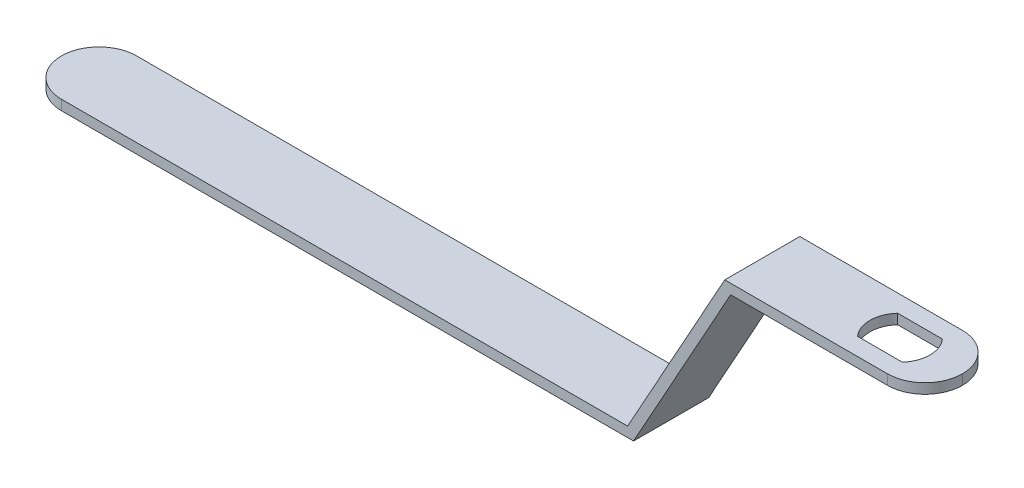
from build123d import *

# Parameters (mm, degrees)
EXTRUDE_THIN1_DEPTH = 15
FILLET1_R           = 7.5
CUT_EXTRUDE1_DEPTH  = 2
WRAP2_START         = 3
WRAP2_DEPTH         = 1


# Read off the part's stored shape, not the designer's step: Wrap2
with BuildPart() as part:
    # Sketch1 → Extrude-Thin1 (new body)
    with BuildSketch(Plane.XY):
        Polygon((0, 0), (120.6, 0), (140, 34.998526452), (180, 34.998526452), (180, 32.998526452), (141.178090033, 32.998526452), (121.778090033, -2), (0, -2), align=None)
    extrude(amount=EXTRUDE_THIN1_DEPTH)

    # Fillet1
    fillet1_edges = [part.edges().sort_by_distance(p)[0] for p in [
        (180, 33.998526452, 0),
        (180, 33.998526452, 15),
        (0, -1, 15),
        (0, -1, 0),
    ]]
    fillet(fillet1_edges, radius=FILLET1_R - 0.0001)  # a hair under: the kernel refuses the full size

    # Sketch2 → Cut-Extrude1 (cut)
    with BuildSketch(Plane(origin=(0, 34.998526452, 0), x_dir=(1, 0, 0), z_dir=(0, 1, 0))):
        with BuildLine():
            Line((163.027864045, -3.5), (171.972135955, -3.5))
            ThreePointArc((171.972135955, -3.5), (173.5, -7.5), (171.972135955, -11.5))
            Line((171.972135955, -11.5), (163.027864045, -11.5))
            ThreePointArc((163.027864045, -11.5), (161.5, -7.5), (163.027864045, -3.5))
        make_face()
    extrude(amount=-CUT_EXTRUDE1_DEPTH, mode=Mode.SUBTRACT)

    # Wrap2 outline → Wrap2 (cut)
    # profile 1 of 8: a face of its own
    with BuildSketch(Plane(origin=(0, -5, 0), x_dir=(1, 0, 0), z_dir=(0, 1, 0)).offset(WRAP2_START)):
        with BuildLine():
            Line((103.636603054, -4.873144755), (102.82250049, -4.873144755))
            add(Edge.make_bspline(
                [(102.82250049, -4.873144755), (102.821956445, -4.725585735), (102.820927731, -4.446571689), (102.814852315, -4.051410181), (102.810755363, -3.703686419), (102.803437305, -3.40345389), (102.793137917, -3.151592025), (102.782579956, -2.948114592), (102.774671335, -2.791737768), (102.763521229, -2.703865036), (102.758898727, -2.66743562)],
                knots=[0, 0, 0, 0, 0.200540395, 0.379194621, 0.537105586, 0.673145943, 0.787337723, 0.87965386, 0.950108077, 1, 1, 1, 1], degree=3))
            add(Edge.make_bspline(
                [(102.758898727, -2.66743562), (102.737223261, -2.542450891), (102.694970442, -2.298813357), (102.555099969, -1.959231973), (102.351856896, -1.66341771), (102.13640676, -1.454616366), (101.936739719, -1.312072973), (101.769235664, -1.218972783), (101.587105526, -1.139157463), (101.389760849, -1.076572685), (101.179078509, -1.025448924), (100.952784878, -0.98991022), (100.712121483, -0.970325277), (100.546440185, -0.967102613), (100.461603054, -0.965452447)],
                knots=[0, 0, 0, 0, 0.119769123, 0.233470552, 0.344312896, 0.457241494, 0.515356631, 0.576072786, 0.638240444, 0.703203992, 0.771713444, 0.843216856, 0.919719169, 1, 1, 1, 1], degree=3))
            add(Edge.make_bspline(
                [(100.461603054, -0.965452447), (100.33161862, -0.969508808), (100.060887184, -0.977957391), (99.644930356, -1.046258984), (99.203629182, -1.150817668), (98.906526538, -1.248115772), (98.751987669, -1.298725684)],
                knots=[0, 0, 0, 0, 0.222818915, 0.464086991, 0.721243174, 1, 1, 1, 1], degree=3))
            Line((98.751987669, -1.298725684), (98.751987669, -3.071942832))
            add(Edge.make_bspline(
                [(98.751987669, -3.071942832), (98.834876883, -3.049025362), (98.99296514, -3.005316624), (99.220429096, -2.956796041), (99.425381019, -2.926834702), (99.554136439, -2.921702031), (99.614427573, -2.919298601)],
                knots=[0, 0, 0, 0, 0.293681303, 0.560115882, 0.794019448, 1, 1, 1, 1], degree=3))
            add(Edge.make_bspline(
                [(99.614427573, -2.919298601), (99.680782209, -2.920696901), (99.805120569, -2.923317101), (99.977471631, -2.956651149), (100.125040886, -3.009137089), (100.201583185, -3.069079833), (100.237724849, -3.097383537)],
                knots=[0, 0, 0, 0, 0.299999302, 0.562152446, 0.79325759, 1, 1, 1, 1], degree=3))
            add(Edge.make_bspline(
                [(100.237724849, -3.097383537), (100.259595062, -3.125320883), (100.307913507, -3.18704361), (100.351831874, -3.312992841), (100.37412874, -3.472181554), (100.378046373, -3.589989445), (100.380192798, -3.654534979)],
                knots=[0, 0, 0, 0, 0.180276456, 0.398289592, 0.670330064, 1, 1, 1, 1], degree=3))
            Line((100.380192798, -3.654534979), (100.387825009, -4.873144755))
            Line((100.387825009, -4.873144755), (98.914808182, -4.873144755))
            Line((98.914808182, -4.873144755), (98.914808182, -6.826990909))
            Line((98.914808182, -6.826990909), (100.54301331, -6.826990909))
            Line((100.54301331, -6.826990909), (100.54301331, -14.153913986))
            Line((100.54301331, -14.153913986), (102.82250049, -14.153913986))
            Line((102.82250049, -14.153913986), (102.82250049, -6.826990909))
            Line((102.82250049, -6.826990909), (103.636603054, -6.826990909))
            Line((103.636603054, -6.826990909), (103.636603054, -4.873144755))
        make_face()
    # profile 2 of 8: a face of its own
    with BuildSketch(Plane(origin=(0, -5, 0), x_dir=(1, 0, 0), z_dir=(0, 1, 0)).offset(WRAP2_START)):
        with BuildLine():
            add(Edge.make_bspline(
                [(93.190649528, -4.710324242), (93.082879775, -4.712242079), (92.869446831, -4.716040264), (92.551565123, -4.747656688), (92.239240721, -4.799240188), (91.930678425, -4.866031815), (91.628743524, -4.959616875), (91.331852407, -5.071857684), (91.037350489, -5.200723259), (90.75254725, -5.354118367), (90.475385199, -5.520489352), (90.212619079, -5.704010199), (89.966430983, -5.903239414), (89.732250821, -6.113557711), (89.520991766, -6.344121662), (89.319153232, -6.583821731), (89.137640063, -6.841245533), (88.969585015, -7.110120245), (88.819966815, -7.388891019), (88.690050924, -7.675618625), (88.577296146, -7.96633885), (88.489011414, -8.264592868), (88.415919793, -8.566447801), (88.369793785, -8.875602657), (88.337001392, -9.188881638), (88.333324326, -9.399806829), (88.331474849, -9.505897159)],
                knots=[0, 0, 0, 0, 0.042598506, 0.084364343, 0.126142289, 0.167705805, 0.209066008, 0.25097289, 0.293148456, 0.336041456, 0.37876116, 0.420892731, 0.462622223, 0.503914433, 0.545187585, 0.586138136, 0.627721928, 0.669584534, 0.711432369, 0.752690541, 0.793970501, 0.834591739, 0.875576584, 0.916639513, 0.958071667, 1, 1, 1, 1], degree=3))
            add(Edge.make_bspline(
                [(88.331474849, -9.505897159), (88.333426665, -9.61281632), (88.337307318, -9.82539585), (88.368607397, -10.141621608), (88.420388341, -10.452230275), (88.487436318, -10.7590517), (88.580671157, -11.05815981), (88.689606114, -11.353963577), (88.823328059, -11.642431084), (88.971167523, -11.926709241), (89.140303094, -12.198432608), (89.321659143, -12.458435175), (89.522652278, -12.699895853), (89.732220145, -12.93030301), (89.960303023, -13.141865307), (90.203260282, -13.338017951), (90.458988588, -13.521158996), (90.729326897, -13.686991609), (91.010812627, -13.832702811), (91.298698574, -13.964073351), (91.594668133, -14.073448706), (91.898108782, -14.162641296), (92.209204545, -14.231700886), (92.527268605, -14.278613887), (92.851615968, -14.311241338), (93.07014845, -14.314891657), (93.180473246, -14.316734499)],
                knots=[0, 0, 0, 0, 0.04216776, 0.083839067, 0.125192329, 0.166335368, 0.207601958, 0.248670144, 0.290582404, 0.332926248, 0.374978427, 0.416740924, 0.457856759, 0.498808992, 0.539515963, 0.580420356, 0.621910028, 0.663502052, 0.705394285, 0.746863727, 0.788245389, 0.82973641, 0.871532383, 0.913824669, 0.956494908, 1, 1, 1, 1], degree=3))
            add(Edge.make_bspline(
                [(93.180473246, -14.316734499), (93.341790595, -14.311999516), (93.659749546, -14.302666794), (94.128027907, -14.238740089), (94.577888831, -14.128705469), (95.01006536, -13.975319634), (95.425118902, -13.778761403), (95.819427203, -13.535490743), (96.196912555, -13.250296958), (96.551036626, -12.925590528), (96.875462248, -12.569358171), (97.158887063, -12.189082301), (97.399537666, -11.790462614), (97.597197546, -11.373044549), (97.749750666, -10.936255712), (97.859920048, -10.481401951), (97.923924911, -10.007204736), (97.9331787, -9.68502147), (97.937885105, -9.521161582)],
                knots=[0, 0, 0, 0, 0.064374939, 0.126883986, 0.188200706, 0.248894086, 0.309598788, 0.371125298, 0.433465539, 0.498143129, 0.562592753, 0.625474489, 0.687114454, 0.748124994, 0.809456656, 0.871431117, 0.934610872, 1, 1, 1, 1], degree=3))
            add(Edge.make_bspline(
                [(97.937885105, -9.521161582), (97.933014574, -9.346195142), (97.923441642, -9.002302107), (97.847428351, -8.498490974), (97.726043324, -8.016115691), (97.551802765, -7.556525614), (97.329225776, -7.118873091), (97.057509714, -6.704081181), (96.735311743, -6.312055928), (96.488572615, -6.074945615), (96.363105458, -5.954374723)],
                knots=[0, 0, 0, 0, 0.130489087, 0.256473689, 0.3792365, 0.500977689, 0.622366534, 0.744855131, 0.870258513, 1, 1, 1, 1], degree=3))
            add(Edge.make_bspline(
                [(96.363105458, -5.954374723), (96.2479768, -5.854435015), (96.020851791, -5.657274661), (95.651848403, -5.407209074), (95.274030573, -5.191228698), (94.882869991, -5.013652659), (94.477276202, -4.87976319), (94.059327645, -4.782303635), (93.629111226, -4.722441121), (93.337546164, -4.714383727), (93.190649528, -4.710324242)],
                knots=[0, 0, 0, 0, 0.131014441, 0.25846437, 0.382579777, 0.504990606, 0.627227493, 0.749296729, 0.873690397, 1, 1, 1, 1], degree=3))
        make_face()
        with BuildLine():
            add(Edge.make_bspline(
                [(93.139768118, -6.826990909), (93.228023606, -6.829924229), (93.401755485, -6.835698501), (93.657493375, -6.866687478), (93.899372964, -6.930202047), (94.132198432, -7.010975196), (94.351851074, -7.118997903), (94.564346393, -7.245409363), (94.758635099, -7.403597749), (94.944119446, -7.577118837), (95.112497888, -7.769809348), (95.25597231, -7.979745515), (95.384169884, -8.198895621), (95.481375604, -8.435283025), (95.561822629, -8.682446572), (95.616268211, -8.944379673), (95.654158535, -9.218156394), (95.656971354, -9.405695324), (95.658397926, -9.500809018)],
                knots=[0, 0, 0, 0, 0.064415632, 0.126802865, 0.187422712, 0.246517508, 0.306285303, 0.365703059, 0.4264774, 0.488621826, 0.550895458, 0.612678531, 0.673914015, 0.735734248, 0.798735035, 0.86329015, 0.930665176, 1, 1, 1, 1], degree=3))
            add(Edge.make_bspline(
                [(95.658397926, -9.500809018), (95.656728643, -9.599276899), (95.653466351, -9.791713463), (95.619684634, -10.072696724), (95.563977469, -10.339347976), (95.484835047, -10.591255301), (95.385300087, -10.830226858), (95.263182233, -11.054921856), (95.117192669, -11.263989291), (94.951675937, -11.45717171), (94.770442185, -11.632525529), (94.571860408, -11.783007616), (94.364246463, -11.913756577), (94.142815798, -12.018768174), (93.910713363, -12.099845646), (93.667250142, -12.159540261), (93.411146736, -12.191700827), (93.236524686, -12.19724048), (93.14740033, -12.200067832)],
                knots=[0, 0, 0, 0, 0.071358163, 0.139455827, 0.204809025, 0.268587499, 0.330586987, 0.392213478, 0.453609543, 0.515091734, 0.576401551, 0.636039465, 0.695407414, 0.753980593, 0.813284842, 0.873377339, 0.935373778, 1, 1, 1, 1], degree=3))
            add(Edge.make_bspline(
                [(93.14740033, -12.200067832), (93.058231397, -12.197560098), (92.883408526, -12.192643484), (92.627004374, -12.155825811), (92.382297851, -12.097882051), (92.14821308, -12.016106773), (91.926642658, -11.90884746), (91.716738393, -11.777472978), (91.516653733, -11.624897821), (91.332987806, -11.446235408), (91.16297177, -11.252450522), (91.013877875, -11.042279435), (90.889289394, -10.81758438), (90.787104531, -10.579779139), (90.707806962, -10.329190574), (90.65302204, -10.064887279), (90.615111459, -9.78768835), (90.612362254, -9.597616451), (90.610962028, -9.500809018)],
                knots=[0, 0, 0, 0, 0.064469005, 0.126396675, 0.18693923, 0.24609921, 0.305348133, 0.364571657, 0.424924428, 0.486952233, 0.549550456, 0.611149272, 0.672921868, 0.735010283, 0.798048595, 0.862642915, 0.93004128, 1, 1, 1, 1], degree=3))
            add(Edge.make_bspline(
                [(90.610962028, -9.500809018), (90.612652546, -9.40403542), (90.615969891, -9.214134227), (90.649754015, -8.93656039), (90.704914485, -8.673111397), (90.785077671, -8.424912154), (90.884021009, -8.1891311), (91.00622327, -7.966975112), (91.152932808, -7.759538363), (91.319254163, -7.56784944), (91.503204722, -7.394956233), (91.698338641, -7.240777463), (91.909118032, -7.113259775), (92.131588547, -7.008139681), (92.366342073, -6.927264773), (92.613115062, -6.867231852), (92.872663796, -6.835528918), (93.049802823, -6.829866656), (93.139768118, -6.826990909)],
                knots=[0, 0, 0, 0, 0.070243401, 0.137840339, 0.202697511, 0.265405501, 0.326938422, 0.388125269, 0.449116585, 0.511100798, 0.572085896, 0.632197341, 0.691338952, 0.750563856, 0.810545842, 0.871334761, 0.934653553, 1, 1, 1, 1], degree=3))
        make_face(mode=Mode.SUBTRACT)
    # profile 3 of 8: a face of its own
    with BuildSketch(Plane(origin=(0, -5, 0), x_dir=(1, 0, 0), z_dir=(0, 1, 0)).offset(WRAP2_START)):
        with BuildLine():
            Line((84.749423567, -4.873144755), (84.749423567, -6.015432415))
            add(Edge.make_bspline(
                [(84.749423567, -6.015432415), (84.69415301, -5.913916997), (84.586124414, -5.715500899), (84.387666822, -5.449166582), (84.159670703, -5.22486725), (83.910328662, -5.03791148), (83.638884991, -4.892197815), (83.35260847, -4.788358459), (83.053948189, -4.720877266), (82.850212269, -4.713867246), (82.747240073, -4.710324242)],
                knots=[0, 0, 0, 0, 0.137332659, 0.268422379, 0.39320538, 0.516430377, 0.637792883, 0.758061252, 0.877719333, 1, 1, 1, 1], degree=3))
            add(Edge.make_bspline(
                [(82.747240073, -4.710324242), (82.67246941, -4.71382547), (82.520209642, -4.720955221), (82.288144328, -4.762400568), (82.05273072, -4.837341636), (81.897808279, -4.904816109), (81.818654336, -4.939290588)],
                knots=[0, 0, 0, 0, 0.232851034, 0.474167851, 0.731338546, 1, 1, 1, 1], degree=3))
            Line((81.818654336, -4.939290588), (82.525905939, -6.870240108))
            add(Edge.make_bspline(
                [(82.525905939, -6.870240108), (82.589124132, -6.839696133), (82.707950001, -6.782285219), (82.880464529, -6.714534425), (83.037028616, -6.673196202), (83.136287374, -6.667028177), (83.182276131, -6.664170396)],
                knots=[0, 0, 0, 0, 0.30359675, 0.570645018, 0.80107043, 1, 1, 1, 1], degree=3))
            add(Edge.make_bspline(
                [(83.182276131, -6.664170396), (83.225698461, -6.666064113), (83.311117666, -6.66978938), (83.437194022, -6.701713655), (83.555931696, -6.756766077), (83.673052649, -6.827293694), (83.779317337, -6.925332356), (83.885516388, -7.038829515), (83.979104678, -7.178956853), (84.077867465, -7.334925698), (84.161960447, -7.525831423), (84.23406759, -7.753733518), (84.298315633, -8.021268966), (84.342527058, -8.32985825), (84.385259176, -8.676515236), (84.410694382, -9.063784343), (84.429651562, -9.490440989), (84.430810667, -9.788262726), (84.431414753, -9.943477287)],
                knots=[0, 0, 0, 0, 0.034014511, 0.066912404, 0.101140702, 0.136380892, 0.173597996, 0.214075626, 0.25797978, 0.305417223, 0.358684712, 0.420923911, 0.492691001, 0.574130849, 0.665182153, 0.766512664, 0.878314341, 1, 1, 1, 1], degree=3))
            Line((84.431414753, -9.943477287), (84.423782541, -10.396321838))
            Line((84.423782541, -10.396321838), (84.423782541, -14.153913986))
            Line((84.423782541, -14.153913986), (86.703269721, -14.153913986))
            Line((86.703269721, -14.153913986), (86.703269721, -4.873144755))
            Line((86.703269721, -4.873144755), (84.749423567, -4.873144755))
        make_face()
    # profile 4 of 8: a face of its own
    with BuildSketch(Plane(origin=(0, -5, 0), x_dir=(1, 0, 0), z_dir=(0, 1, 0)).offset(WRAP2_START)):
        with BuildLine():
            Line((78.399423567, -4.873144755), (78.399423567, -5.982359499))
            add(Edge.make_bspline(
                [(78.399423567, -5.982359499), (78.298033135, -5.880027416), (78.098403709, -5.678543957), (77.767578698, -5.419518857), (77.422494713, -5.198020395), (77.058969883, -5.018703451), (76.677893375, -4.881782012), (76.281071292, -4.781448001), (75.866465392, -4.722254078), (75.584174811, -4.714344934), (75.44066956, -4.710324242)],
                knots=[0, 0, 0, 0, 0.130191077, 0.256335531, 0.379114138, 0.500550811, 0.622115809, 0.744714581, 0.870223095, 1, 1, 1, 1], degree=3))
            add(Edge.make_bspline(
                [(75.44066956, -4.710324242), (75.296974832, -4.714844081), (75.014116408, -4.723741238), (74.601427935, -4.805158563), (74.210471543, -4.937434205), (73.845548671, -5.12597688), (73.50402187, -5.358817283), (73.201021004, -5.647984683), (72.928283811, -5.981967953), (72.782904388, -6.234462896), (72.70833783, -6.363970076)],
                knots=[0, 0, 0, 0, 0.127995722, 0.251955439, 0.373413672, 0.494801292, 0.617068654, 0.7406196, 0.866961201, 1, 1, 1, 1], degree=3))
            add(Edge.make_bspline(
                [(72.70833783, -6.363970076), (72.612286467, -6.234110587), (72.423764595, -5.979232854), (72.089592407, -5.646461075), (71.728252571, -5.35878713), (71.332753992, -5.124257889), (70.913599743, -4.938077765), (70.47262399, -4.80565004), (70.013824766, -4.723877309), (69.701586717, -4.714879462), (69.543514112, -4.710324242)],
                knots=[0, 0, 0, 0, 0.130148748, 0.25544547, 0.37917652, 0.501904822, 0.625344245, 0.74827832, 0.872564212, 1, 1, 1, 1], degree=3))
            add(Edge.make_bspline(
                [(69.543514112, -4.710324242), (69.380243881, -4.715054136), (69.062290286, -4.724265164), (68.601529868, -4.81488556), (68.169971979, -4.954907668), (67.77715393, -5.158674105), (67.421955364, -5.40004352), (67.119283337, -5.685231556), (66.86809321, -6.004286784), (66.704536225, -6.302206518), (66.598801029, -6.565601678), (66.534957178, -6.79480482), (66.475243425, -7.050739117), (66.432345068, -7.336844686), (66.392301346, -7.650432357), (66.36905439, -7.993586965), (66.353253193, -8.365152503), (66.351574906, -8.622236676), (66.350705618, -8.755396358)],
                knots=[0, 0, 0, 0, 0.082624488, 0.16090351, 0.236985873, 0.311729383, 0.384306569, 0.453908175, 0.521546124, 0.589231814, 0.625292706, 0.665128129, 0.709631799, 0.75836798, 0.811604142, 0.869763281, 0.932542404, 1, 1, 1, 1], degree=3))
            Line((66.350705618, -8.755396358), (66.350705618, -14.153913986))
            Line((66.350705618, -14.153913986), (68.630192798, -14.153913986))
            Line((68.630192798, -14.153913986), (68.630192798, -9.493176806))
            add(Edge.make_bspline(
                [(68.630192798, -9.493176806), (68.632090039, -9.36851075), (68.635731622, -9.129225521), (68.651213396, -8.786016544), (68.685868227, -8.474755618), (68.726488131, -8.193718651), (68.784615997, -7.944395732), (68.855492374, -7.726185837), (68.937708541, -7.538774861), (69.036982084, -7.382182335), (69.14816857, -7.250306694), (69.271847495, -7.137263153), (69.406729319, -7.040814643), (69.554036942, -6.958605996), (69.717629448, -6.903006659), (69.891984211, -6.859381436), (70.07846561, -6.829672347), (70.207398807, -6.827901178), (70.273662349, -6.826990909)],
                knots=[0, 0, 0, 0, 0.1043212, 0.200235118, 0.287286636, 0.36626042, 0.437682721, 0.501179832, 0.55802122, 0.608412149, 0.655743055, 0.701943669, 0.748215056, 0.794251934, 0.84250453, 0.892236791, 0.944616499, 1, 1, 1, 1], degree=3))
            add(Edge.make_bspline(
                [(70.273662349, -6.826990909), (70.375773528, -6.830521157), (70.576146398, -6.837448566), (70.868130509, -6.903647721), (71.142889708, -7.011876254), (71.399394636, -7.159111587), (71.632125875, -7.343005736), (71.835706795, -7.56112173), (72.003836244, -7.814716592), (72.120219547, -8.050001756), (72.192944493, -8.262746821), (72.244245332, -8.444945885), (72.284232297, -8.650986075), (72.315530382, -8.878780683), (72.345557241, -9.129617454), (72.36028825, -9.403179195), (72.375362567, -9.699085864), (72.375166331, -9.90359544), (72.375064592, -10.00962312)],
                knots=[0, 0, 0, 0, 0.070619589, 0.138576891, 0.20607346, 0.274463188, 0.342600369, 0.410740079, 0.480118385, 0.552600476, 0.591784346, 0.635663039, 0.683568788, 0.736964635, 0.79487093, 0.858420857, 0.926598508, 1, 1, 1, 1], degree=3))
            Line((72.375064592, -10.00962312), (72.375064592, -14.153913986))
            Line((72.375064592, -14.153913986), (74.654551772, -14.153913986))
            Line((74.654551772, -14.153913986), (74.654551772, -9.704334659))
            add(Edge.make_bspline(
                [(74.654551772, -9.704334659), (74.654743158, -9.605103181), (74.655111324, -9.414213961), (74.666177642, -9.138566275), (74.680831609, -8.884043437), (74.701374764, -8.64993554), (74.725067249, -8.436533756), (74.759260964, -8.24500554), (74.795184616, -8.074295514), (74.856776204, -7.880374019), (74.943566671, -7.665476549), (75.073232898, -7.437589748), (75.230017076, -7.246788258), (75.409956494, -7.091587237), (75.613295758, -6.973336513), (75.83488365, -6.885372671), (76.078951254, -6.837892489), (76.246951075, -6.830701454), (76.33363831, -6.826990909)],
                knots=[0, 0, 0, 0, 0.078530458, 0.151067163, 0.218305464, 0.280286667, 0.337063553, 0.388152346, 0.434234333, 0.474994116, 0.549030637, 0.617296196, 0.681662637, 0.743542005, 0.804319575, 0.867012585, 0.931379026, 1, 1, 1, 1], degree=3))
            add(Edge.make_bspline(
                [(76.33363831, -6.826990909), (76.431587427, -6.830315472), (76.625576472, -6.836899796), (76.908151151, -6.907620823), (77.178318749, -7.013863565), (77.430135856, -7.165205513), (77.659360984, -7.353427253), (77.860903627, -7.577747373), (78.028149491, -7.837899795), (78.145049398, -8.079674966), (78.216713927, -8.297727727), (78.269394171, -8.484657761), (78.307893367, -8.695235421), (78.340014999, -8.927096293), (78.369864088, -9.180514063), (78.384656049, -9.456603164), (78.399715471, -9.755057574), (78.399523213, -9.961261522), (78.399423567, -10.068136742)],
                knots=[0, 0, 0, 0, 0.067433272, 0.13355216, 0.199704678, 0.267120188, 0.335277742, 0.403628311, 0.474205446, 0.54799425, 0.588135642, 0.632411552, 0.681857329, 0.73562936, 0.793897036, 0.857789304, 0.926292394, 1, 1, 1, 1], degree=3))
            Line((78.399423567, -10.068136742), (78.399423567, -14.153913986))
            Line((78.399423567, -14.153913986), (80.678910746, -14.153913986))
            Line((80.678910746, -14.153913986), (80.678910746, -4.873144755))
            Line((80.678910746, -4.873144755), (78.399423567, -4.873144755))
        make_face()
    # profile 5 of 8: a face of its own
    with BuildSketch(Plane(origin=(0, -5, 0), x_dir=(1, 0, 0), z_dir=(0, 1, 0)).offset(WRAP2_START)):
        with BuildLine():
            Line((57.069936387, -14.153913986), (57.069936387, -13.141373922))
            add(Edge.make_bspline(
                [(57.069936387, -13.141373922), (57.182884137, -13.23993349), (57.402093415, -13.43121815), (57.747496304, -13.679414859), (58.093908501, -13.884145067), (58.442994525, -14.047201512), (58.800119682, -14.167601914), (59.16785513, -14.254774618), (59.55149665, -14.306182494), (59.812290871, -14.313180525), (59.944736067, -14.316734499)],
                knots=[0, 0, 0, 0, 0.141149604, 0.273943506, 0.399987178, 0.519718967, 0.636176176, 0.754371141, 0.875256582, 1, 1, 1, 1], degree=3))
            add(Edge.make_bspline(
                [(59.944736067, -14.316734499), (60.093411687, -14.313389762), (60.387203139, -14.306780374), (60.818309478, -14.237205893), (61.234585508, -14.130706643), (61.635693328, -13.979996892), (62.020903159, -13.784706602), (62.393163024, -13.549931168), (62.746091256, -13.267428568), (63.082625859, -12.94942197), (63.390754924, -12.59961245), (63.660124261, -12.222855315), (63.887182593, -11.824494034), (64.073199334, -11.405849359), (64.219525523, -10.967228549), (64.323835157, -10.507240435), (64.385377961, -10.02572073), (64.392995226, -9.697728365), (64.396859464, -9.531337864)],
                knots=[0, 0, 0, 0, 0.061279783, 0.121092325, 0.179634237, 0.238303512, 0.297437091, 0.357506849, 0.419513154, 0.483600041, 0.548295031, 0.611486872, 0.674312645, 0.737107248, 0.800159515, 0.864737133, 0.931381158, 1, 1, 1, 1], degree=3))
            add(Edge.make_bspline(
                [(64.396859464, -9.531337864), (64.392803932, -9.359040281), (64.384848554, -9.021059374), (64.326655437, -8.525088462), (64.224270708, -8.05369498), (64.08466177, -7.60622598), (63.905079114, -7.182604155), (63.686359438, -6.782135478), (63.425527265, -6.405866709), (63.124964425, -6.060202208), (62.80043038, -5.743383997), (62.453236324, -5.467568619), (62.088811613, -5.233250622), (61.706768982, -5.041956205), (61.307162989, -4.894133561), (60.891571271, -4.786063138), (60.458148896, -4.721217088), (60.162898061, -4.713985345), (60.013425971, -4.710324242)],
                knots=[0, 0, 0, 0, 0.071017617, 0.139308968, 0.205473642, 0.26959838, 0.332253223, 0.394830003, 0.45737553, 0.520581844, 0.583374035, 0.644082429, 0.703039519, 0.761664045, 0.819843943, 0.878346403, 0.938412308, 1, 1, 1, 1], degree=3))
            add(Edge.make_bspline(
                [(60.013425971, -4.710324242), (59.874966383, -4.713200769), (59.601004767, -4.718892379), (59.198320663, -4.78069237), (58.807775162, -4.874160469), (58.431498708, -5.007335685), (58.066404957, -5.175496488), (57.718773752, -5.386214509), (57.381000346, -5.630633363), (57.17490546, -5.821529666), (57.069936387, -5.918757736)],
                knots=[0, 0, 0, 0, 0.127126465, 0.251537451, 0.373434128, 0.49566655, 0.617680221, 0.742091207, 0.86864086, 1, 1, 1, 1], degree=3))
            Line((57.069936387, -5.918757736), (57.069936387, -4.873144755))
            Line((57.069936387, -4.873144755), (54.790449208, -4.873144755))
            Line((54.790449208, -4.873144755), (54.790449208, -14.153913986))
            Line((54.790449208, -14.153913986), (57.069936387, -14.153913986))
        make_face()
        with BuildLine():
            add(Edge.make_bspline(
                [(59.535140714, -6.826990909), (59.625971559, -6.829777913), (59.803994084, -6.835240258), (60.065800569, -6.868096648), (60.31600903, -6.92599107), (60.552835, -7.011517647), (60.779808056, -7.115701479), (60.993481577, -7.246190014), (61.195619074, -7.400424689), (61.385031756, -7.574671486), (61.557709324, -7.766200573), (61.706567466, -7.975200306), (61.833072837, -8.196039327), (61.940063503, -8.429381625), (62.016644546, -8.677988359), (62.0772967, -8.938623113), (62.108771241, -9.213415139), (62.114476584, -9.400677399), (62.117372285, -9.495720877)],
                knots=[0, 0, 0, 0, 0.065523004, 0.128420809, 0.189995948, 0.250359009, 0.30974405, 0.369855539, 0.430536995, 0.492876096, 0.555257199, 0.616197084, 0.67757746, 0.738630831, 0.800921896, 0.864881541, 0.931421696, 1, 1, 1, 1], degree=3))
            add(Edge.make_bspline(
                [(62.117372285, -9.495720877), (62.114520816, -9.591626454), (62.10890203, -9.780607281), (62.076787787, -10.057717276), (62.018318148, -10.322159291), (61.933013149, -10.571795492), (61.828835958, -10.809994299), (61.702028889, -11.035656401), (61.546268614, -11.244791809), (61.373439675, -11.442349369), (61.180141222, -11.618760603), (60.976859949, -11.775397583), (60.760819195, -11.906455644), (60.53436285, -12.012377597), (60.298253175, -12.098695086), (60.049530073, -12.155861894), (59.790630098, -12.192407552), (59.614131148, -12.197496773), (59.524964432, -12.200067832)],
                knots=[0, 0, 0, 0, 0.068696036, 0.135364742, 0.199460916, 0.262263612, 0.323991109, 0.385461119, 0.447170687, 0.510418175, 0.573170928, 0.634270788, 0.693953647, 0.753722967, 0.813083582, 0.873628543, 0.936157536, 1, 1, 1, 1], degree=3))
            add(Edge.make_bspline(
                [(59.524964432, -12.200067832), (59.432441757, -12.197265204), (59.251047016, -12.191770528), (58.984969291, -12.159213989), (58.731399633, -12.101107291), (58.491393028, -12.015091055), (58.261283604, -11.911655056), (58.043147891, -11.783716368), (57.839352991, -11.629835619), (57.648866776, -11.454013626), (57.47432288, -11.260920588), (57.323406148, -11.049180156), (57.191952153, -10.825564371), (57.088569634, -10.58478614), (57.006469416, -10.331057957), (56.947564404, -10.062805133), (56.915523492, -9.779738458), (56.909953848, -9.586534422), (56.907115875, -9.488088665)],
                knots=[0, 0, 0, 0, 0.065625544, 0.128661741, 0.189789734, 0.249707447, 0.309188905, 0.368499841, 0.428643518, 0.489936978, 0.552121002, 0.612878024, 0.674050383, 0.735729182, 0.798304624, 0.862952782, 0.930168555, 1, 1, 1, 1], degree=3))
            add(Edge.make_bspline(
                [(56.907115875, -9.488088665), (56.909918583, -9.391336129), (56.915393087, -9.20235032), (56.947702588, -8.925193943), (57.007025793, -8.662208379), (57.087436253, -8.412910227), (57.192657978, -8.177869503), (57.324211435, -7.959692249), (57.473472697, -7.750819441), (57.649949046, -7.562942915), (57.839403354, -7.388394008), (58.046195388, -7.239166726), (58.263810077, -7.110558512), (58.49358445, -7.004966209), (58.737646113, -6.927563047), (58.991649105, -6.867632612), (59.259556399, -6.835259978), (59.441780201, -6.829792246), (59.535140714, -6.826990909)],
                knots=[0, 0, 0, 0, 0.069163211, 0.135095843, 0.199062931, 0.26154836, 0.322044302, 0.382646423, 0.443384787, 0.505154721, 0.566515904, 0.627254268, 0.687026267, 0.746970113, 0.807538884, 0.869732605, 0.933258824, 1, 1, 1, 1], degree=3))
        make_face(mode=Mode.SUBTRACT)
    # profile 6 of 8: a face of its own
    with BuildSketch(Plane(origin=(0, -5, 0), x_dir=(1, 0, 0), z_dir=(0, 1, 0)).offset(WRAP2_START)):
        with BuildLine():
            Line((40.787885105, -3.65707905), (42.459339432, -5.254755332))
            add(Edge.make_bspline(
                [(42.459339432, -5.254755332), (42.601125805, -5.108147985), (42.878079012, -4.821777905), (43.324354853, -4.442649156), (43.788465478, -4.126696641), (44.261382542, -3.860603446), (44.751612452, -3.659284978), (45.253486815, -3.51258082), (45.770210247, -3.42314084), (46.11990879, -3.412907324), (46.295797766, -3.40776014)],
                knots=[0, 0, 0, 0, 0.139406438, 0.272304448, 0.399525336, 0.522810878, 0.642662717, 0.761022621, 0.879800797, 1, 1, 1, 1], degree=3))
            add(Edge.make_bspline(
                [(46.295797766, -3.40776014), (46.442686434, -3.411826595), (46.732555039, -3.419851296), (47.15815811, -3.478680273), (47.565269443, -3.578721509), (47.955282645, -3.716596862), (48.327050085, -3.895000252), (48.681351219, -4.113793599), (49.017312533, -4.371000887), (49.330496173, -4.665291315), (49.616985561, -4.986825722), (49.870117176, -5.329902167), (50.082155509, -5.693734681), (50.25617192, -6.074638637), (50.391723977, -6.474377045), (50.488525176, -6.892680787), (50.544512402, -7.33004803), (50.552868871, -7.627367022), (50.557115875, -7.778473281)],
                knots=[0, 0, 0, 0, 0.064714517, 0.127706968, 0.188882163, 0.249158299, 0.309661029, 0.370224886, 0.432332222, 0.495781859, 0.559304077, 0.621860558, 0.683321537, 0.744522975, 0.806088371, 0.868994315, 0.933419057, 1, 1, 1, 1], degree=3))
            add(Edge.make_bspline(
                [(50.557115875, -7.778473281), (50.555891937, -7.884530225), (50.55347953, -8.093570643), (50.527071472, -8.402799437), (50.484548271, -8.702824472), (50.423006664, -8.993191291), (50.34604828, -9.274151528), (50.255758572, -9.548129012), (50.142491461, -9.811337991), (50.016763259, -10.066835468), (49.870542809, -10.307649873), (49.71289019, -10.537286394), (49.541941664, -10.754619376), (49.356589988, -10.958760355), (49.154226566, -11.146519064), (48.940081746, -11.323541631), (48.7105432, -11.485396582), (48.470379025, -11.636145845), (48.217514507, -11.767103013), (47.958810446, -11.885724906), (47.690344367, -11.98206352), (47.415385005, -12.059721232), (47.13491497, -12.125757518), (46.846191003, -12.166418089), (46.551715979, -12.197209863), (46.352700291, -12.199111075), (46.252548567, -12.200067832)],
                knots=[0, 0, 0, 0, 0.045985853, 0.090639062, 0.134485273, 0.177331356, 0.219264833, 0.260785002, 0.302316572, 0.343435729, 0.384181474, 0.424375739, 0.464181122, 0.504011983, 0.543822462, 0.583802465, 0.624418535, 0.66554756, 0.70667494, 0.747826979, 0.788895117, 0.830219358, 0.871706937, 0.913733854, 0.956587828, 1, 1, 1, 1], degree=3))
            add(Edge.make_bspline(
                [(46.252548567, -12.200067832), (46.082674031, -12.195154159), (45.748914742, -12.185500069), (45.259074996, -12.110006454), (44.792306518, -11.985823729), (44.419360737, -11.839171147), (44.127167569, -11.694349818), (43.904725229, -11.560397221), (43.674702513, -11.410556533), (43.440919901, -11.239172606), (43.200747803, -11.048302115), (42.958425808, -10.833764639), (42.707750433, -10.602624592), (42.543535479, -10.437655399), (42.459339432, -10.35307264)],
                knots=[0, 0, 0, 0, 0.117048429, 0.229969726, 0.340703508, 0.449355147, 0.505556512, 0.56530267, 0.628204956, 0.694728992, 0.765018834, 0.839580202, 0.9177498, 1, 1, 1, 1], degree=3))
            Line((42.459339432, -10.35307264), (40.838766516, -12.055055813))
            add(Edge.make_bspline(
                [(40.838766516, -12.055055813), (40.952684069, -12.165039634), (41.175026771, -12.379704532), (41.510424564, -12.684508656), (41.845400245, -12.958409046), (42.171861501, -13.211347084), (42.495156107, -13.435954072), (42.815249777, -13.632454326), (43.128518913, -13.805817624), (43.441468646, -13.953120277), (43.756046314, -14.078195529), (44.079709766, -14.185877111), (44.413448472, -14.276971856), (44.759300755, -14.350473351), (45.114040717, -14.409411627), (45.480988253, -14.449194623), (45.857816732, -14.475939407), (46.113425328, -14.478342648), (46.242372285, -14.479555011)],
                knots=[0, 0, 0, 0, 0.077782936, 0.151815657, 0.222539839, 0.290277535, 0.354640607, 0.415797753, 0.474709008, 0.5304261, 0.585579746, 0.640906165, 0.697901091, 0.755420321, 0.814521258, 0.874461831, 0.936669717, 1, 1, 1, 1], degree=3))
            add(Edge.make_bspline(
                [(46.242372285, -14.479555011), (46.479231871, -14.473516988), (46.942700242, -14.461702255), (47.621901056, -14.374163082), (48.267123597, -14.227405201), (48.879937571, -14.019849079), (49.460148118, -13.754705859), (50.007606801, -13.429652722), (50.521431239, -13.045553282), (50.997470742, -12.606909558), (51.428071129, -12.122464389), (51.808672004, -11.60230318), (52.123505063, -11.04386953), (52.384917735, -10.455413287), (52.589339007, -9.834249097), (52.733216927, -9.17970505), (52.821945391, -8.492413148), (52.831652411, -8.022976935), (52.836603054, -7.783561422)],
                knots=[0, 0, 0, 0, 0.067376243, 0.131836579, 0.194461068, 0.255345968, 0.31558834, 0.375627452, 0.436137852, 0.49777862, 0.559470361, 0.62027777, 0.680787689, 0.741491622, 0.803215436, 0.866492763, 0.931910443, 1, 1, 1, 1], degree=3))
            add(Edge.make_bspline(
                [(52.836603054, -7.783561422), (52.834511152, -7.627416666), (52.830365514, -7.317975924), (52.786794472, -6.862144641), (52.726053907, -6.417790676), (52.629694523, -5.989527895), (52.513542789, -5.571586809), (52.369092848, -5.16850995), (52.196575405, -4.779138834), (52.001551105, -4.402821629), (51.780922065, -4.042023618), (51.534455207, -3.699844624), (51.268495548, -3.373643088), (50.976652513, -3.067746678), (50.663166961, -2.779469566), (50.326623542, -2.510373979), (49.969046397, -2.256600784), (49.589467697, -2.024694175), (49.195261644, -1.81492232), (48.791400215, -1.629894586), (48.37887565, -1.475254008), (47.95943214, -1.346985354), (47.531297543, -1.251241873), (47.097527773, -1.178767147), (46.654431971, -1.138253311), (46.356931526, -1.131620938), (46.206755298, -1.12827296)],
                knots=[0, 0, 0, 0, 0.044663331, 0.088511806, 0.130925591, 0.172904037, 0.21400012, 0.25498502, 0.295291276, 0.335772442, 0.376180821, 0.416178408, 0.456350051, 0.496512167, 0.537040574, 0.578118744, 0.619724561, 0.66242197, 0.705298954, 0.747430001, 0.789432984, 0.831267421, 0.872825096, 0.91487011, 0.957027003, 1, 1, 1, 1], degree=3))
            add(Edge.make_bspline(
                [(46.206755298, -1.12827296), (46.078639576, -1.130192104), (45.823740181, -1.134010439), (45.444152207, -1.165840415), (45.0676, -1.215829069), (44.695431732, -1.291251303), (44.324985276, -1.380787026), (43.961128712, -1.498021705), (43.598122008, -1.628701848), (43.241658384, -1.784903275), (42.891240268, -1.955411242), (42.555076758, -2.148858723), (42.227523699, -2.353341176), (41.915839471, -2.580960768), (41.614185556, -2.823461313), (41.324139329, -3.081974214), (41.048246115, -3.360809637), (40.875110853, -3.557823324), (40.787885105, -3.65707905)],
                knots=[0, 0, 0, 0, 0.062275778, 0.123904062, 0.185067241, 0.246840152, 0.30843533, 0.370241251, 0.432586589, 0.495924582, 0.559351071, 0.621942654, 0.684392867, 0.746985808, 0.809441465, 0.872507833, 0.935769297, 1, 1, 1, 1], degree=3))
        make_face()
    # profile 7 of 8: a face of its own
    with BuildSketch(Plane(origin=(0, -5, 0), x_dir=(1, 0, 0), z_dir=(0, 1, 0)).offset(WRAP2_START)):
        with BuildLine():
            Line((25.4827569, -1.453913986), (22.610501291, -1.453913986))
            add(Edge.make_bspline(
                [(22.610501291, -1.453913986), (22.38657593, -1.455479301), (21.953725674, -1.458505072), (21.326611286, -1.492598239), (20.743474707, -1.545031111), (20.203940036, -1.617162027), (19.709113405, -1.712610982), (19.259632884, -1.832332989), (18.853989909, -1.970532128), (18.487736687, -2.133151459), (18.153382724, -2.322749448), (17.835902964, -2.533946387), (17.535920773, -2.774479035), (17.249226374, -3.03970704), (16.97951962, -3.334482666), (16.722308927, -3.65392336), (16.48389198, -4.002661454), (16.25706195, -4.372335308), (16.051924371, -4.764511563), (15.87299571, -5.175852098), (15.723106085, -5.603709783), (15.601313003, -6.048540603), (15.504229861, -6.508867855), (15.436302743, -6.985620437), (15.394309521, -7.478356954), (15.39004966, -7.812308685), (15.387885105, -7.981998922)],
                knots=[0, 0, 0, 0, 0.060148162, 0.116267077, 0.168653955, 0.217398969, 0.262433523, 0.303932701, 0.342259967, 0.377441339, 0.411406099, 0.445398351, 0.479766387, 0.514584482, 0.550213651, 0.587000908, 0.624662987, 0.663615456, 0.703456428, 0.743450162, 0.784013386, 0.825132536, 0.867264663, 0.910306473, 0.954424205, 1, 1, 1, 1], degree=3))
            add(Edge.make_bspline(
                [(15.387885105, -7.981998922), (15.393553079, -8.221442891), (15.404710816, -8.692802361), (15.49869736, -9.384516952), (15.650705426, -10.047594379), (15.864442573, -10.676847791), (16.129419419, -11.266673595), (16.445963934, -11.806670461), (16.809434837, -12.293939958), (17.215597672, -12.726055884), (17.655373101, -13.097465378), (18.112388453, -13.415550431), (18.591095891, -13.666387037), (19.012904044, -13.825454955), (19.378664337, -13.924381438), (19.699797917, -13.982847942), (20.064572898, -14.036465253), (20.476390488, -14.077899557), (20.933444135, -14.114848774), (21.43755566, -14.13492554), (21.987092893, -14.151606353), (22.36879846, -14.15312462), (22.567252092, -14.153913986)],
                knots=[0, 0, 0, 0, 0.065772947, 0.129477895, 0.191430088, 0.252445668, 0.311786958, 0.36881755, 0.424091518, 0.478492106, 0.531393744, 0.58200397, 0.631201271, 0.679503008, 0.705561374, 0.735221723, 0.769132486, 0.80685832, 0.848929771, 0.895116661, 0.945469804, 1, 1, 1, 1], degree=3))
            Line((22.567252092, -14.153913986), (25.4827569, -14.153913986))
            Line((25.4827569, -14.153913986), (25.4827569, -1.453913986))
        make_face()
        with BuildLine():
            Line((23.203269721, -11.874426806), (22.012644721, -11.874426806))
            add(Edge.make_bspline(
                [(22.012644721, -11.874426806), (21.870978631, -11.874167215), (21.598507579, -11.873667936), (21.205121057, -11.849886809), (20.841338271, -11.826017116), (20.508160628, -11.78071164), (20.203163367, -11.730244528), (19.93053635, -11.660012632), (19.684659551, -11.586239974), (19.468536306, -11.492318237), (19.270585023, -11.386603072), (19.087304746, -11.262745499), (18.910387964, -11.125206336), (18.743142279, -10.96994036), (18.584934707, -10.799003585), (18.436701303, -10.611515248), (18.296463544, -10.408047382), (18.167821068, -10.187524203), (18.050266884, -9.952274485), (17.945983151, -9.704576963), (17.859516548, -9.442368852), (17.787650801, -9.168104735), (17.736294576, -8.879396832), (17.693807095, -8.578383561), (17.671903561, -8.263872333), (17.668897437, -8.049868382), (17.667372285, -7.941293793)],
                knots=[0, 0, 0, 0, 0.062614648, 0.120428813, 0.174199486, 0.223724664, 0.26902845, 0.310765001, 0.348115258, 0.382378114, 0.414753161, 0.447195432, 0.480044579, 0.513738641, 0.547962504, 0.582917814, 0.619315101, 0.657123545, 0.695686576, 0.735513716, 0.7758232, 0.817652262, 0.860742584, 0.905386927, 0.951998197, 1, 1, 1, 1], degree=3))
            add(Edge.make_bspline(
                [(17.667372285, -7.941293793), (17.670409871, -7.7749135), (17.676332927, -7.45048482), (17.733453605, -6.977947365), (17.826435172, -6.532982562), (17.95911091, -6.117241795), (18.12635279, -5.729556613), (18.335694987, -5.373211532), (18.57812822, -5.042220445), (18.769837807, -4.848050453), (18.865629496, -4.75102937)],
                knots=[0, 0, 0, 0, 0.142276686, 0.277428514, 0.406477152, 0.530595072, 0.650142922, 0.766850697, 0.883502093, 1, 1, 1, 1], degree=3))
            add(Edge.make_bspline(
                [(18.865629496, -4.75102937), (18.960089172, -4.668354292), (19.153012365, -4.499499807), (19.491722092, -4.297168951), (19.86496267, -4.119401462), (20.281272724, -3.978451669), (20.736628801, -3.866982564), (21.233743012, -3.790105047), (21.769953202, -3.74070437), (22.141427128, -3.735887722), (22.333197605, -3.733401165)],
                knots=[0, 0, 0, 0, 0.101663476, 0.207636138, 0.318744567, 0.436679942, 0.563506646, 0.698681208, 0.844446556, 1, 1, 1, 1], degree=3))
            Line((22.333197605, -3.733401165), (23.203269721, -3.733401165))
            Line((23.203269721, -3.733401165), (23.203269721, -11.874426806))
        make_face(mode=Mode.SUBTRACT)
    # profile 8 of 8: a face of its own
    with BuildSketch(Plane(origin=(0, -5, 0), x_dir=(1, 0, 0), z_dir=(0, 1, 0)).offset(WRAP2_START)):
        Polygon((32.484038951, -1.453913986), (27.355192798, -14.153913986), (29.789868278, -14.153913986), (30.776967637, -11.548785781), (36.310321003, -11.548785781), (37.297420362, -14.153913986), (39.729551772, -14.153913986), (34.598161548, -1.453913986), align=None)
        Polygon((33.542372285, -4.860424402), (35.445337028, -9.269298601), (31.639407541, -9.269298601), align=None, mode=Mode.SUBTRACT)
    extrude(amount=WRAP2_DEPTH, mode=Mode.SUBTRACT)


solid = part.part
